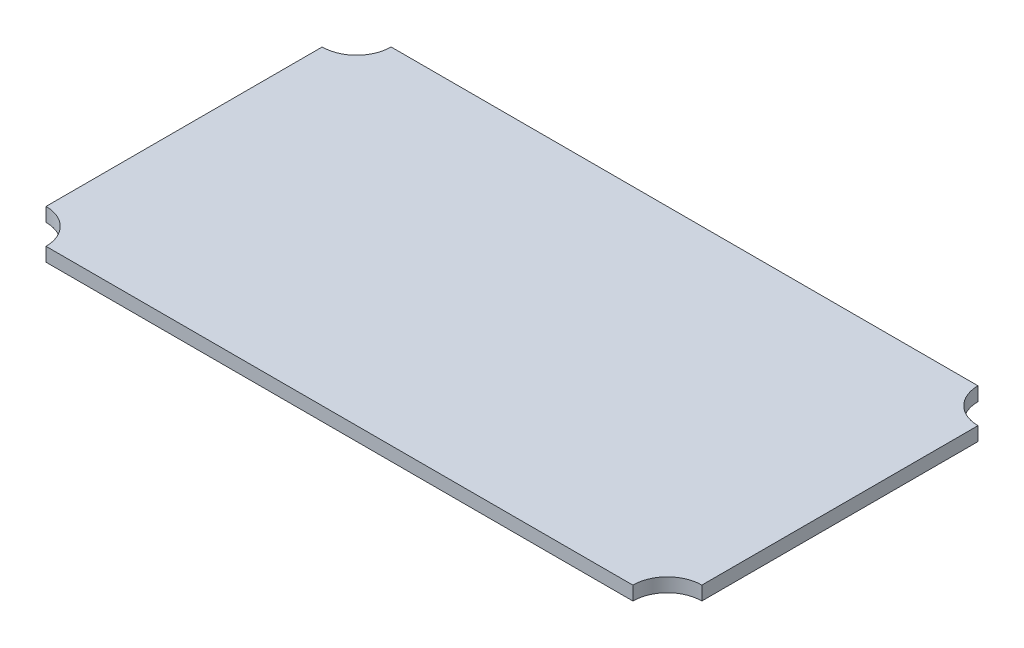
from build123d import *

# Parameters (mm, degrees)
SKETCH1_W           = 95
SKETCH1_H           = 50
BOSS_EXTRUDE1_DEPTH = 1
CAVITY1_START       = -1
CAVITY1_DEPTH       = 2


# Read off the part's stored shape, not the designer's step: Cavity1
with BuildPart() as part:
    # Sketch1 → Boss-Extrude1 (new, symmetric)
    with BuildSketch(Plane(origin=(0, 0, 0), x_dir=(1, 0, 0), z_dir=(0, 1, 0))):
        Rectangle(SKETCH1_W, SKETCH1_H)
    extrude(amount=BOSS_EXTRUDE1_DEPTH, both=True)

    # Cavity1 outline → Cavity1 (cut)
    with BuildSketch(Plane(origin=(0, 0, 0), x_dir=(1, 0, 0), z_dir=(0, 1, 0)).offset(CAVITY1_START)):
        with BuildLine():
            Line((47.5, -25), (47.5, -20))
            ThreePointArc((47.5, -20), (43.964466094, -21.464466094), (42.5, -25))
            Line((42.5, -25), (47.5, -25))
        make_face()
        with BuildLine():
            ThreePointArc((42.5, 25), (43.964466094, 21.464466094), (47.5, 20))
            Line((47.5, 20), (47.5, 25))
            Line((47.5, 25), (42.5, 25))
        make_face()
        with BuildLine():
            Line((-47.5, -25), (-42.5, -25))
            ThreePointArc((-42.5, -25), (-43.964466094, -21.464466094), (-47.5, -20))
            Line((-47.5, -20), (-47.5, -25))
        make_face()
        with BuildLine():
            ThreePointArc((-47.5, 20), (-43.964466094, 21.464466094), (-42.5, 25))
            Line((-42.5, 25), (-47.5, 25))
            Line((-47.5, 25), (-47.5, 20))
        make_face()
    extrude(amount=CAVITY1_DEPTH, mode=Mode.SUBTRACT)


solid = part.part
